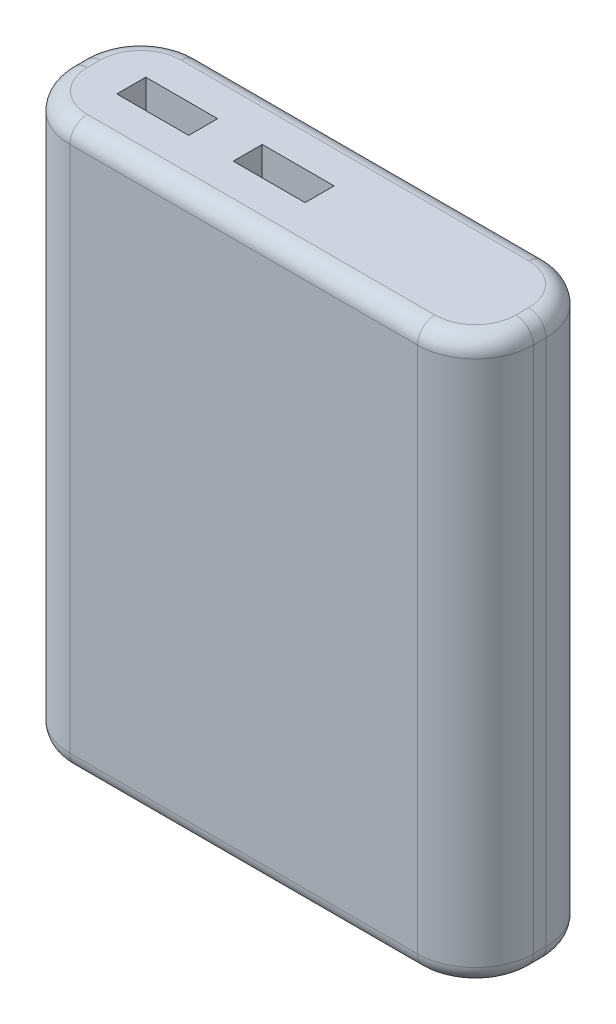
from build123d import *

# Parameters (mm, degrees)
BOSS_EXTRUDE1_DEPTH = 97
FILLET1_R           = 3
SKETCH2_W           = 12.4
SKETCH2_H           = 5
CUT_EXTRUDE1_DEPTH  = 10


with BuildPart() as part:
    # Sketch1 → Boss-Extrude1 (new body)
    with BuildSketch(Plane(origin=(0, 0, 0), x_dir=(1, 0, 0), z_dir=(0, 1, 0))):
        with BuildLine():
            Line((-30, 11.1), (30, 11.1))
            ThreePointArc((30, 11.1), (37.071067812, 8.171067812), (40, 1.1))
            Line((40, 1.1), (40, -1.1))
            ThreePointArc((40, -1.1), (37.071067812, -8.171067812), (30, -11.1))
            Line((30, -11.1), (-30, -11.1))
            ThreePointArc((-30, -11.1), (-37.071067812, -8.171067812), (-40, -1.1))
            Line((-40, -1.1), (-40, 1.1))
            ThreePointArc((-40, 1.1), (-37.071067812, 8.171067812), (-30, 11.1))
        make_face()
    extrude(amount=BOSS_EXTRUDE1_DEPTH)

    # Fillet1
    fillet1_edges = [part.edges().sort_by_distance(p)[0] for p in [
        (0, 97, 11.1),
        (-37.071067812, 97, 8.171067812),
        (-40, 97, 0),
        (-37.071067812, 97, -8.171067812),
        (0, 97, -11.1),
        (37.071067812, 97, -8.171067812),
        (40, 97, 0),
        (37.071067812, 97, 8.171067812),
        (40, 0, 0),
        (37.071067812, 0, -8.171067812),
        (0, 0, -11.1),
        (-37.071067812, 0, -8.171067812),
        (-40, 0, 0),
        (-37.071067812, 0, 8.171067812),
        (0, 0, 11.1),
        (37.071067812, 0, 8.171067812),
    ]]
    fillet(fillet1_edges, radius=FILLET1_R)

    # Sketch2 → Cut-Extrude1 (cut)
    with BuildSketch(Plane(origin=(0, 97, 0), x_dir=(1, 0, 0), z_dir=(0, 1, 0))):
        with Locations((-24.3, 0)):
            Rectangle(SKETCH2_W, SKETCH2_H)
        with Locations((-4.2, 0)):
            Rectangle(SKETCH2_W, SKETCH2_H)
    extrude(amount=-CUT_EXTRUDE1_DEPTH, mode=Mode.SUBTRACT)


solid = part.part
